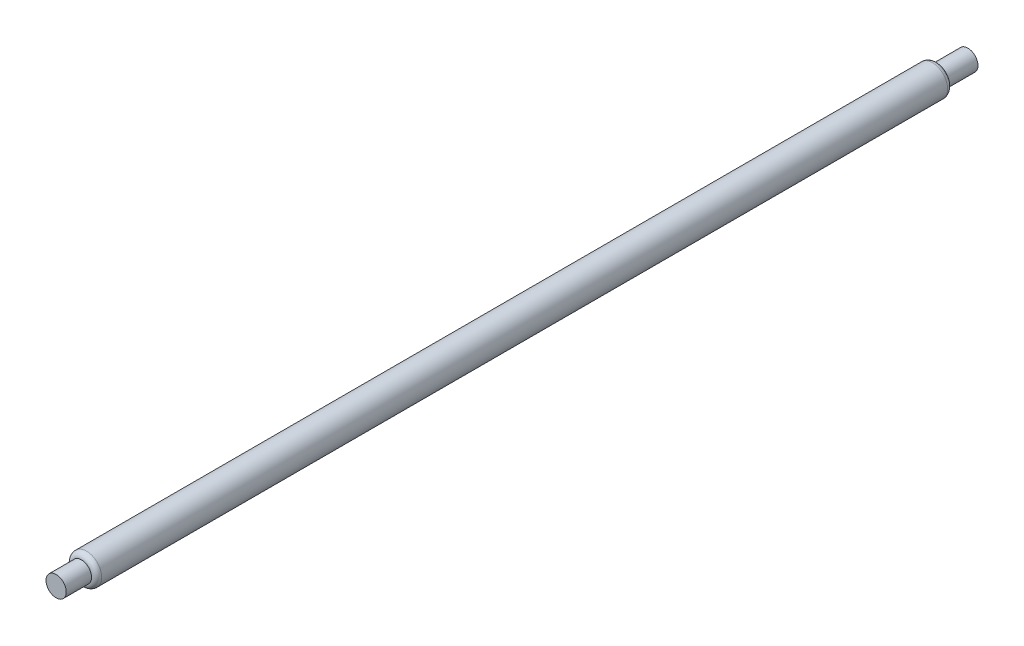
from build123d import *

# Parameters (mm, degrees)
SKETCH1_R              = 6
BOSS_EXTRUDE1_DEPTH    = 180
SKETCH2_R              = 6
SKETCH2_R_2            = 4
CUT_EXTRUDE1_DEPTH     = 10
FILLET1_R              = 2
FILLET1_OF_MIRROR1_R   = 2
MOVE_START             = -180.0000001
MOVE_FACE1_2_OUTLINE_W = 16
MOVE_FACE1_2_OUTLINE_H = 16
MOVE_FACE1_2_OUTLINE_R = 4
MOVE_FACE1_2_DEPTH     = 12.0000001


with BuildPart() as part:
    # Sketch1 → Boss-Extrude1 (new, symmetric)
    with BuildSketch(Plane.XY):
        with Locations(Location((0, 0, 0), (0, 0, 180))):
            Circle(SKETCH1_R)
    extrude(amount=BOSS_EXTRUDE1_DEPTH, both=True)

    # Sketch2 → Cut-Extrude1 (cut)
    with BuildSketch(Plane.XY.offset(180)):
        with Locations(Location((0, 0, 0), (0, 0, 180))):
            Circle(SKETCH2_R)
        Circle(SKETCH2_R_2, mode=Mode.SUBTRACT)
    cut_extrude1 = extrude(amount=-CUT_EXTRUDE1_DEPTH, mode=Mode.SUBTRACT)

    # Fillet1
    fillet1_edges = [part.edges().sort_by_distance(p)[0] for p in [
        (6, 0, 170),
    ]]
    fillet(fillet1_edges, radius=FILLET1_R - 0.0001)  # a hair under: the kernel refuses the full size

    # Mirror1: Cut-Extrude1 across plane
    add(cut_extrude1.mirror(Plane.XY), mode=Mode.SUBTRACT)

    # Fillet1 of Mirror1
    fillet1_of_mirror1_edges = [part.edges().sort_by_distance(p)[0] for p in [
        (6, 0, -170),
    ]]
    fillet(fillet1_of_mirror1_edges, radius=FILLET1_OF_MIRROR1_R - 0.0001)  # a hair under: the kernel refuses the full size

    # Move Face1: read off the stored shape, not the designer's step
    # Move Face1 outline → Move Face1 (revolve, cut)
    with BuildSketch(Plane.XZ):
        with BuildLine():
            Line((6, -168), (6, -166))
            ThreePointArc((6, -166), (5.414213562, -167.414213562), (4, -168))
            Line((4, -168), (6, -168))
        make_face()
    revolve(axis=Axis((0, 0, 0), (0, 0, 1)), mode=Mode.SUBTRACT)

    # Move Face1 2 outline → Move Face1 2 (cut)
    with BuildSketch(Plane.XY.offset(MOVE_START)):
        Rectangle(MOVE_FACE1_2_OUTLINE_W, MOVE_FACE1_2_OUTLINE_H)
        Circle(MOVE_FACE1_2_OUTLINE_R, mode=Mode.SUBTRACT)
    extrude(amount=MOVE_FACE1_2_DEPTH, mode=Mode.SUBTRACT)


solid = part.part
